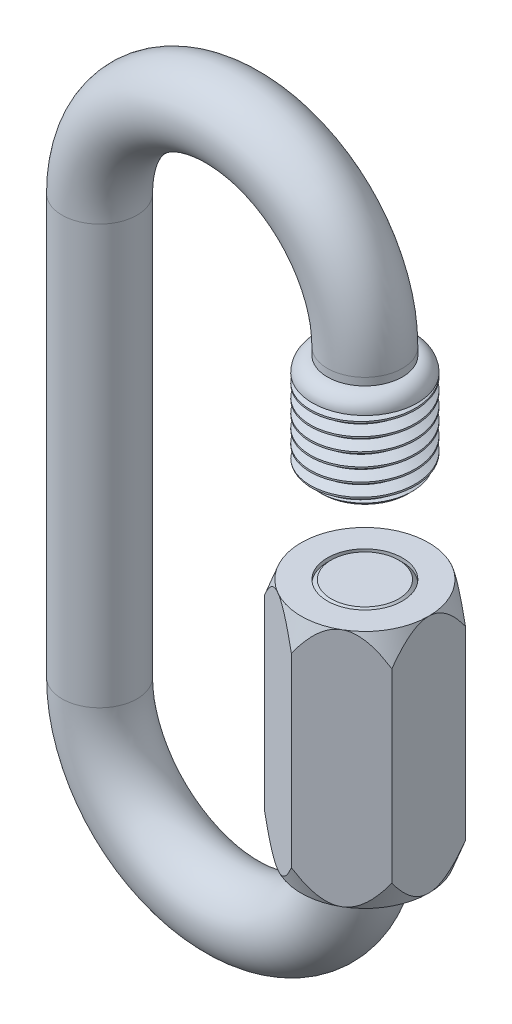
from build123d import *
from build123d.topology import SkipClean

# Parameters (mm, degrees)
SKETCH2_R           = 2.5
CHAMFER1_SIZE       = 0.254
BOSS_EXTRUDE1_START = 0.53
SKETCH6_R           = 2.5
BOSS_EXTRUDE1_DEPTH = 16
SKETCH7_OUTSIDE_W   = 59.99
SKETCH7_OUTSIDE_H   = 45.354
SKETCH7_OUTSIDE_R   = 4.25
CUT_EXTRUDE1_DEPTH  = 30.392445262
CUT_EXTRUDE1_DRAFT  = -20
SKETCH8_OUTSIDE_W   = 69.986
SKETCH8_OUTSIDE_H   = 55.35
SKETCH8_OUTSIDE_R   = 4.25
CUT_EXTRUDE2_DEPTH  = 44.122122414
CUT_EXTRUDE2_DRAFT  = -20
CUT_SWEEP1_PITCH    = 0.875


with BuildPart() as part:
    # Sweep1: sweep along a path in Sketch3
    with BuildLine(Plane.XY) as sweep1_path:
        Line((8.85, 6.88), (8.85, 13.47))
        Line((8.85, 13.47), (8.85, 13.97))
        ThreePointArc((8.85, 13.97), (0, 22.82), (-8.85, 13.97))
        Line((-8.85, 13.97), (-8.85, -13.97))
        ThreePointArc((-8.85, -13.97), (0, -22.82), (8.85, -13.97))
        Line((8.85, -13.97), (8.85, 0.53))
    # Sketch2 → Sweep1 (sweep)
    with BuildSketch(Plane(origin=(0, 0, 0), x_dir=(1, 0, 0), z_dir=(0, 1, 0))):
        with Locations((-8.85, 0)):
            Circle(SKETCH2_R)
    sweep(path=sweep1_path.line)

    # Sketch5 → Revolve1 (revolve)
    with BuildSketch(Plane.XY, mode=Mode.PRIVATE) as revolve1_sk:
        with BuildLine():
            Line((8.85, 6.88), (11.69375, 6.88))
            Line((11.69375, 6.88), (12.35, 7.53625))
            Line((12.35, 7.53625), (12.35, 12.47))
            ThreePointArc((12.35, 12.47), (12.057106781, 13.177106781), (11.35, 13.47))
            Line((11.35, 13.47), (8.85, 13.47))
            Line((8.85, 13.47), (8.85, 6.88))
        make_face()
    revolve(revolve1_sk.sketch.rotate(Axis((8.85, 6.88, 0), (0, 1, 0)), 90), axis=Axis((8.85, 6.88, 0), (0, 1, 0)))

    # Chamfer1
    chamfer1_edges = [part.edges().sort_by_distance(p)[0] for p in [
        (11.35, 0.53, 0),
    ]]
    chamfer(chamfer1_edges, length=CHAMFER1_SIZE)


with BuildPart() as body_2:
    # Sketch6 → Boss-Extrude1 (new body)
    with BuildSketch(Plane(origin=(0, 0, 0), x_dir=(1, 0, 0), z_dir=(0, 1, 0)).offset(BOSS_EXTRUDE1_START)):
        Polygon((13.1, -2.453738644), (13.1, 2.453738644), (8.85, 4.907477288), (4.6, 2.453738644), (4.6, -2.453738644), (8.85, -4.907477288), align=None)
        with Locations(Location((8.85, 0, 0), (0, 0, 270))):
            Circle(SKETCH6_R, mode=Mode.SUBTRACT)
    extrude(amount=-BOSS_EXTRUDE1_DEPTH)


with BuildPart() as cut_extrude1_tool:
    # Sketch7 outside → Cut-Extrude1 (with draft: the straight prism first)
    with BuildSketch(Plane(origin=(0, 0.53, 0), x_dir=(1, 0, 0), z_dir=(0, 1, 0))):
        with Locations((0.875, 0)):
            Rectangle(SKETCH7_OUTSIDE_W, SKETCH7_OUTSIDE_H)
        with Locations((8.85, 0)):
            Circle(SKETCH7_OUTSIDE_R, mode=Mode.SUBTRACT)
    extrude(amount=-CUT_EXTRUDE1_DEPTH)
    # Cut-Extrude1: the draft: its side faces are tilted about the plane it starts from
    cut_extrude1_sides = [cut_extrude1_tool.faces().sort_by_distance(p)[0] for p in [
        (0.875, -14.666222631, 22.677),
        (30.87, -14.666222631, 0),
        (0.875, -14.666222631, -22.677),
        (-29.12, -14.666222631, 0),
        (4.6, -14.666222631, 0),
    ]]
    draft(cut_extrude1_sides, Plane(origin=(0, 0.53, 0), x_dir=(1, 0, 0), z_dir=(0, 1, 0)), CUT_EXTRUDE1_DRAFT)


with BuildPart() as body_2_1:
    add(body_2.part)

    # Cut-Extrude1: cut by cut_extrude1_tool
    add(cut_extrude1_tool.part, mode=Mode.SUBTRACT)


with BuildPart() as cut_extrude2_tool:
    # Sketch8 outside → Cut-Extrude2 (with draft: the straight prism first)
    with BuildSketch(Plane.XZ.offset(15.47)):
        with Locations((0.875, 0)):
            Rectangle(SKETCH8_OUTSIDE_W, SKETCH8_OUTSIDE_H)
        with Locations((8.85, 0)):
            Circle(SKETCH8_OUTSIDE_R, mode=Mode.SUBTRACT)
    extrude(amount=-CUT_EXTRUDE2_DEPTH)
    # Cut-Extrude2: the draft: its side faces are tilted about the plane it starts from
    cut_extrude2_sides = [cut_extrude2_tool.faces().sort_by_distance(p)[0] for p in [
        (0.875, 6.591061207, -27.675),
        (35.868, 6.591061207, 0),
        (0.875, 6.591061207, 27.675),
        (-34.118, 6.591061207, 0),
        (4.6, 6.591061207, 0),
    ]]
    draft(cut_extrude2_sides, Plane.XZ.offset(15.47), CUT_EXTRUDE2_DRAFT)


with BuildPart() as body_2_2:
    add(body_2_1.part)

    # Cut-Extrude2: cut by cut_extrude2_tool
    add(cut_extrude2_tool.part, mode=Mode.SUBTRACT)


with BuildPart() as body_3:
    # Split1: the piece on the far side of the plane
    add(part.part)
    split(bisect_by=Plane.ZX.offset(13.47), keep=Keep.BOTTOM)

    # Cut-Sweep1: the profile of Sketch11 screwed along a right-hand helix of 8.531429 turns, 8 arcs to a turn; built about Z, then put on its axis
    cut_sweep1_z = Axis((0, 0, 0), (0, 0, 1))
    cut_sweep1_corners = [(3.547360764, 0, 0.02734375), (2.931670829, 0, -0.328125), (2.931670829, 0, -0.4375), (3.547360764, 0, -0.79296875)]
    with BuildLine(mode=Mode.PRIVATE) as cut_sweep1_profile:
        Line(cut_sweep1_corners[0], cut_sweep1_corners[1])
        Line(cut_sweep1_corners[1], cut_sweep1_corners[2])
        Line(cut_sweep1_corners[2], cut_sweep1_corners[3])
        Line(cut_sweep1_corners[3], cut_sweep1_corners[0])
    cut_sweep1_cap = Face(cut_sweep1_profile.wire())
    cut_sweep1_turn_angles = [0, 22.5, 45, 67.5, 90, 112.5, 135, 157.5, 180, 202.5, 225, 247.5, 270, 292.5, 315, 337.5, 360]
    cut_sweep1_turn_weights = [1, 0.9238795325112867, 1, 0.9238795325112867, 1, 0.9238795325112867, 1, 0.9238795325112867, 1, 0.9238795325112867, 1, 0.9238795325112867, 1, 0.9238795325112867, 1, 0.9238795325112867, 1]
    cut_sweep1_turn_rails = [Edge.make_bspline([Vector(p[0], p[1], 0).rotate(cut_sweep1_z, cut_sweep1_turn_angles[k]) / cut_sweep1_turn_weights[k] + Vector(0, 0, p[2] + CUT_SWEEP1_PITCH * cut_sweep1_turn_angles[k] / 360) for k in range(17)], [0, 0, 0, 1, 1, 2, 2, 3, 3, 4, 4, 5, 5, 6, 6, 7, 7, 8, 8, 8], 2, cut_sweep1_turn_weights) for p in cut_sweep1_corners]
    cut_sweep1_turn_sides = [Face.make_surface_from_curves(cut_sweep1_turn_rails[p[0]], cut_sweep1_turn_rails[p[1]]) for p in [(0, 1), (1, 2), (2, 3), (3, 0)]]
    cut_sweep1_last_angles = [2880, 2902.5, 2925, 2947.5, 2970, 2992.5, 3015, 3037.5, 3060, 3065.657142857, 3071.314285714]
    cut_sweep1_last_weights = [1, 0.9238795325112867, 1, 0.9238795325112867, 1, 0.9238795325112867, 1, 0.9238795325112867, 1, 0.995129582585918, 1]
    cut_sweep1_last_rails = [Edge.make_bspline([Vector(p[0], p[1], 0).rotate(cut_sweep1_z, cut_sweep1_last_angles[k]) / cut_sweep1_last_weights[k] + Vector(0, 0, p[2] + CUT_SWEEP1_PITCH * cut_sweep1_last_angles[k] / 360) for k in range(11)], [0, 0, 0, 1, 1, 2, 2, 3, 3, 4, 4, 5, 5, 5], 2, cut_sweep1_last_weights) for p in cut_sweep1_corners]
    cut_sweep1_last_sides = [Face.make_surface_from_curves(cut_sweep1_last_rails[p[0]], cut_sweep1_last_rails[p[1]]) for p in [(0, 1), (1, 2), (2, 3), (3, 0)]]
    cut_sweep1 = Plane(origin=(8.85, 6.88, 0), x_dir=(1, 0, 0), z_dir=(0, 1, 0)) * Solid(Shell([*[p.moved(Location((0, 0, CUT_SWEEP1_PITCH * i))) for i in range(8) for p in cut_sweep1_turn_sides], *cut_sweep1_last_sides, cut_sweep1_cap, cut_sweep1_cap.rotate(cut_sweep1_z, 3071.314285714).moved(Location((0, 0, CUT_SWEEP1_PITCH * 3071.314285714 / 360)))]))
    add(cut_sweep1, mode=Mode.SUBTRACT)


with BuildPart() as part_1:
    add(part.part)

    # Split1
    split(bisect_by=Plane.ZX.offset(13.47), keep=Keep.TOP)

    with SkipClean():  # the faces are left unmerged after this step: merging them gives an invalid solid
        add(body_3.part)  # Revolve2 merges body 3
        # Sketch12 → Revolve2 (revolve)
        with BuildSketch(Plane.XY):
            with BuildLine():
                Line((11.35, 13.97), (11.35, 13.47))
                ThreePointArc((11.35, 13.47), (12.057106781, 13.177106781), (12.35, 12.47))
                Line((12.35, 12.47), (8.85, 12.47))
                Line((8.85, 12.47), (8.85, 13.97))
                Line((8.85, 13.97), (11.35, 13.97))
            make_face()
        revolve(axis=Axis((8.85, 13.47, 0), (0, -1, 0)))


solid = Compound([body_2_2.part, part_1.part])
